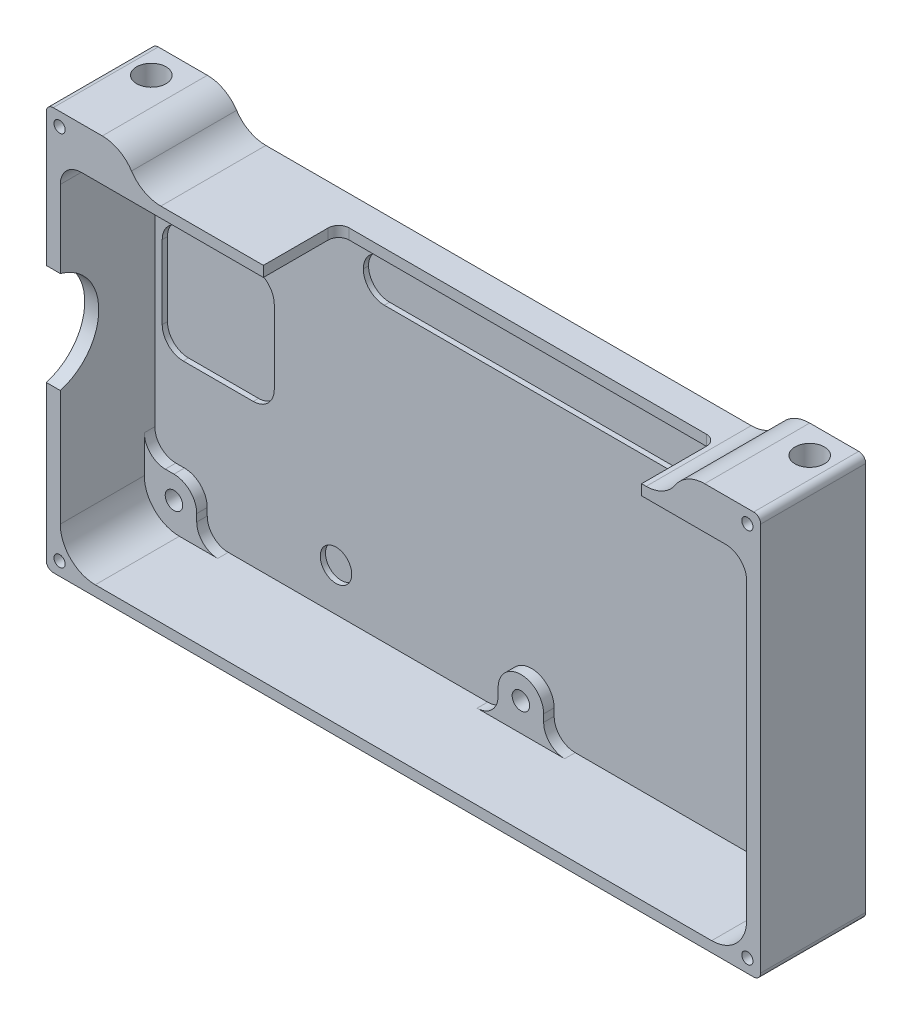
from build123d import *

# Parameters (mm, degrees)
SKIZZE1_W                                 = 98
SKIZZE1_H                                 = 50
SKIZZE1_W_2                               = 102
SKIZZE1_H_2                               = 57.5
AUFSATZ_LINEAR_AUSTRAGEN1_DEPTH           = 15
SKIZZE4_W                                 = 98
SKIZZE4_H                                 = 50
SCHNITT_LINEAR_AUSTRAGEN1_DEPTH           = 13.5
SKIZZE5_R                                 = 3.25
AUFSATZ_LINEAR_AUSTRAGEN2_DEPTH           = 1.5
SCHNITT_LINEAR_AUSTRAGEN3_REACH           = 120.048
SCHNITT_LINEAR_AUSTRAGEN4_REACH           = 120.048
AUFSATZ_LINEAR_AUSTRAGEN3_DEPTH           = 1.5
M3_GEWINDEBOHRUNG1_D                      = 2.5
GEWINDEBOHRUNG_F_R_M4X0_7_HELICOIL1_D     = 4.2
GEWINDEBOHRUNG_F_R_M4X0_7_HELICOIL1_DEPTH = 4
GEWINDEBOHRUNG_F_R_M4X0_7_HELICOIL1_TIP   = 1.2618073
VERRUNDUNG1_R                             = 5
VERRUNDUNG2_R                             = 3
VERRUNDUNG3_R                             = 1
VERRUNDUNG4_R                             = 3
M2_GEWINDEBOHRUNG1_D                      = 1.6
M2_GEWINDEBOHRUNG1_DEPTH                  = 6
M2_GEWINDEBOHRUNG1_TIP                    = 0.480688495
SCHNITT_LINEAR_AUSTRAGEN5_DEPTH           = 119.047659867
SKIZZE20_R                                = 2.25
AUFSATZ_LINEAR_AUSTRAGEN4_DEPTH           = 3
VERRUNDUNG5_R                             = 3
SKIZZE21_R                                = 2.25
SKIZZE21_W                                = 52
SKIZZE21_H                                = 6
SKIZZE21_W_2                              = 16
SKIZZE21_H_2                              = 16.5
SKIZZE21_W_3                              = 6
SKIZZE21_H_3                              = 10
SCHNITT_LINEAR_AUSTRAGEN6_DEPTH           = 0.75
VERRUNDUNG6_R                             = 3


with BuildPart() as part:
    # Skizze1 → Aufsatz-Linear austragen1 (new body)
    with BuildSketch(Plane.XY):
        with Locations((51, 26.5)):
            Rectangle(SKIZZE1_W, SKIZZE1_H)
        with Locations((51, 28.75)):
            Rectangle(SKIZZE1_W_2, SKIZZE1_H_2)
    extrude(amount=AUFSATZ_LINEAR_AUSTRAGEN1_DEPTH)

    # Skizze4 → Schnitt-Linear austragen1 (cut)
    with BuildSketch(Plane.XY.offset(15)):
        with Locations((51, 26.5)):
            Rectangle(SKIZZE4_W, SKIZZE4_H)
    extrude(amount=-SCHNITT_LINEAR_AUSTRAGEN1_DEPTH, mode=Mode.SUBTRACT)

    # Skizze5 → Aufsatz-Linear austragen2 (add)
    with BuildSketch(Plane.XY.offset(1.5)):
        with Locations((6.235, 5.55)):
            Circle(SKIZZE5_R)
        with Locations((55.765, 5.55)):
            Circle(SKIZZE5_R)
        with Locations((95.765, 5.55)):
            Circle(SKIZZE5_R)
        with Locations((95.765, 47.45)):
            Circle(SKIZZE5_R)
        with Locations((6.235, 47.45)):
            Circle(SKIZZE5_R)
    extrude(amount=AUFSATZ_LINEAR_AUSTRAGEN2_DEPTH)

    # Skizze11 → Schnitt-Linear austragen3 (cut, up to next)
    with BuildSketch(Plane.ZY, mode=Mode.PRIVATE) as schnitt_linear_austragen3_sk1:
        with BuildLine():
            Line((17, 37.75), (17, 22.75))
            ThreePointArc((17, 22.75), (9.5, 30.25), (17, 37.75))
        make_face()
    schnitt_linear_austragen3_tool1 = extrude(schnitt_linear_austragen3_sk1.sketch, amount=-SCHNITT_LINEAR_AUSTRAGEN3_REACH, mode=Mode.PRIVATE) & part.part
    add(schnitt_linear_austragen3_tool1.solids().sort_by_distance((0, 30.25, 13.816901))[0], mode=Mode.SUBTRACT)

    # Skizze12 → Schnitt-Linear austragen4 (cut, up to next)
    with BuildSketch(Plane(origin=(0, 57.5, 0), x_dir=(1, 0, 0), z_dir=(0, 1, 0)), mode=Mode.PRIVATE) as schnitt_linear_austragen4_sk1:
        with BuildLine():
            Line((85, -5.75), (85, -15))
            Line((85, -15), (31, -15))
            Line((31, -15), (31, -5.75))
            ThreePointArc((31, -5.75), (31.439339828, -4.689339828), (32.5, -4.25))
            Line((32.5, -4.25), (83.5, -4.25))
            ThreePointArc((83.5, -4.25), (84.560660172, -4.689339828), (85, -5.75))
        make_face()
    schnitt_linear_austragen4_tool1 = extrude(schnitt_linear_austragen4_sk1.sketch, amount=-SCHNITT_LINEAR_AUSTRAGEN4_REACH, mode=Mode.PRIVATE) & part.part
    add(schnitt_linear_austragen4_tool1.solids().sort_by_distance((58, 57.5, 9.633398))[0], mode=Mode.SUBTRACT)

    # Skizze13 → Aufsatz-Linear austragen3 (add)
    with BuildSketch(Plane.XY.offset(1.5)):
        with BuildLine():
            Line((6.235, 44.2), (2, 44.2))
            Line((2, 44.2), (2, 51.5))
            Line((2, 51.5), (9.485, 51.5))
            Line((9.485, 51.5), (9.485, 47.45))
            ThreePointArc((9.485, 47.45), (8.533097039, 45.151902961), (6.235, 44.2))
        make_face()
        with BuildLine():
            Line((9.485, 5.55), (9.485, 1.5))
            Line((9.485, 1.5), (2, 1.5))
            Line((2, 1.5), (2, 8.8))
            Line((2, 8.8), (6.235, 8.8))
            ThreePointArc((6.235, 8.8), (8.533097039, 7.848097039), (9.485, 5.55))
        make_face()
        with BuildLine():
            Line((100, 1.5), (100, 8.8))
            Line((100, 8.8), (95.765, 8.8))
            ThreePointArc((95.765, 8.8), (93.466902961, 7.848097039), (92.515, 5.55))
            Line((92.515, 5.55), (92.515, 1.5))
            Line((92.515, 1.5), (100, 1.5))
        make_face()
        with BuildLine():
            Line((100, 51.5), (92.515, 51.5))
            Line((92.515, 51.5), (92.515, 47.45))
            ThreePointArc((92.515, 47.45), (93.466902961, 45.151902961), (95.765, 44.2))
            Line((95.765, 44.2), (100, 44.2))
            Line((100, 44.2), (100, 51.5))
        make_face()
        with BuildLine():
            Line((59.015, 5.55), (59.015, 1.5))
            Line((59.015, 1.5), (52.515, 1.5))
            Line((52.515, 1.5), (52.515, 5.55))
            ThreePointArc((52.515, 5.55), (55.765, 8.8), (59.015, 5.55))
        make_face()
    extrude(amount=AUFSATZ_LINEAR_AUSTRAGEN3_DEPTH)

    # M3 Gewindebohrung1 (through all)
    with Locations(Plane.XY.offset(3)):
        with Locations((6.235, 47.45), (6.235, 5.55), (55.765, 5.55), (95.765, 47.45), (95.765, 5.55)):
            Hole(M3_GEWINDEBOHRUNG1_D / 2)

    # Gewindebohrung für M4x0.7 Helicoil1
    with Locations(Plane(origin=(38.515151917, 57.5, 4.646014508), x_dir=(-1, 0, 0), z_dir=(0, 1, 0))):
        with Locations((34.515151917, -0.646014508), (-59.484848083, -0.646014508)):
            Hole(GEWINDEBOHRUNG_F_R_M4X0_7_HELICOIL1_D / 2, depth=GEWINDEBOHRUNG_F_R_M4X0_7_HELICOIL1_DEPTH)
            with Locations((0, 0, -(GEWINDEBOHRUNG_F_R_M4X0_7_HELICOIL1_DEPTH + GEWINDEBOHRUNG_F_R_M4X0_7_HELICOIL1_TIP / 2))):  # 118° drill point
                Cone(0, GEWINDEBOHRUNG_F_R_M4X0_7_HELICOIL1_D / 2, GEWINDEBOHRUNG_F_R_M4X0_7_HELICOIL1_TIP, mode=Mode.SUBTRACT)

    # Verrundung1
    verrundung1_edges = [part.edges().sort_by_distance(p)[0] for p in [
        (2, 1.5, 9),
        (100, 1.5, 9),
    ]]
    fillet(verrundung1_edges, radius=VERRUNDUNG1_R)

    # Verrundung2
    verrundung2_edges = [part.edges().sort_by_distance(p)[0] for p in [
        (100, 44.2, 2.25),
        (92.515, 51.5, 2.25),
        (9.485, 51.5, 2.25),
        (2, 44.2, 2.25),
        (52.515, 1.5, 2.25),
        (59.015, 1.5, 2.25),
        (9.485, 1.5, 2.25),
        (2, 8.8, 2.25),
        (92.515, 1.5, 2.25),
        (100, 8.8, 2.25),
    ]]
    fillet(verrundung2_edges, radius=VERRUNDUNG2_R)

    # Verrundung3
    verrundung3_edges = [part.edges().sort_by_distance(p)[0] for p in [
        (0, 0, 7.5),
        (0, 57.5, 7.5),
        (102, 57.5, 7.5),
        (102, 0, 7.5),
    ]]
    fillet(verrundung3_edges, radius=VERRUNDUNG3_R)

    # Verrundung4
    verrundung4_edges = [part.edges().sort_by_distance(p)[0] for p in [
        (100, 51.5, 9),
        (2, 51.5, 9),
    ]]
    fillet(verrundung4_edges, radius=VERRUNDUNG4_R)

    # M2 Gewindebohrung1
    with Locations(Plane.XY.offset(15)):
        with Locations((1.9, 55.6), (100.1, 55.6), (100.1, 1.9), (1.9, 1.9)):
            Hole(M2_GEWINDEBOHRUNG1_D / 2, depth=M2_GEWINDEBOHRUNG1_DEPTH)
            with Locations((0, 0, -(M2_GEWINDEBOHRUNG1_DEPTH + M2_GEWINDEBOHRUNG1_TIP / 2))):  # 118° drill point
                Cone(0, M2_GEWINDEBOHRUNG1_D / 2, M2_GEWINDEBOHRUNG1_TIP, mode=Mode.SUBTRACT)

    # Skizze19 → Schnitt-Linear austragen5 (cut, through all)
    with BuildSketch(Plane.XY.offset(15)):
        with BuildLine():
            Line((94, 57.5), (8, 57.5))
            ThreePointArc((8, 57.5), (10.371708245, 56.901704215), (12.175823272, 55.25))
            ThreePointArc((12.175823272, 55.25), (13.979938299, 53.598295785), (16.351646544, 53))
            Line((16.351646544, 53), (85.648353456, 53))
            ThreePointArc((85.648353456, 53), (88.020061701, 53.598295785), (89.824176728, 55.25))
            ThreePointArc((89.824176728, 55.25), (91.628291755, 56.901704215), (94, 57.5))
        make_face()
    extrude(amount=-SCHNITT_LINEAR_AUSTRAGEN5_DEPTH, mode=Mode.SUBTRACT)

    # Skizze20 → Aufsatz-Linear austragen4 (add)
    with BuildSketch(Plane(origin=(0, 0, 0), x_dir=(-1, 0, 0), z_dir=(0, 0, -1))):
        Polygon((-47, -8), (-51, -8), (-55, -8), (-55, 0), (-47, 0), align=None)
        with Locations((-51, -4)):
            Circle(SKIZZE20_R, mode=Mode.SUBTRACT)
    extrude(amount=-AUFSATZ_LINEAR_AUSTRAGEN4_DEPTH)

    # Verrundung5
    verrundung5_edges = [part.edges().sort_by_distance(p)[0] for p in [
        (55, -8, 1.5),
        (55, 0, 1.5),
        (47, 0, 1.5),
        (47, -8, 1.5),
    ]]
    fillet(verrundung5_edges, radius=VERRUNDUNG5_R)

    # Skizze21 → Schnitt-Linear austragen6 (cut)
    with BuildSketch(Plane.XY.offset(1.5)):
        with Locations((89.465, 7.6)):
            Circle(SKIZZE21_R)
        with Locations((27.865, 7.6)):
            Circle(SKIZZE21_R)
        with Locations((57.765, 46.2)):
            Rectangle(SKIZZE21_W, SKIZZE21_H)
        with Locations((11.055, 30.2)):
            Rectangle(SKIZZE21_W_2, SKIZZE21_H_2)
        with Locations((97, 35.71)):
            Rectangle(SKIZZE21_W_3, SKIZZE21_H_3)
    extrude(amount=-SCHNITT_LINEAR_AUSTRAGEN6_DEPTH, mode=Mode.SUBTRACT)

    # Verrundung6
    verrundung6_edges = [part.edges().sort_by_distance(p)[0] for p in [
        (3.055, 21.95, 1.125),
        (3.055, 38.45, 1.125),
        (19.055, 38.45, 1.125),
        (19.055, 21.95, 1.125),
        (31.765, 43.2, 1.125),
        (31.765, 49.2, 1.125),
        (83.765, 49.2, 1.125),
        (83.765, 43.2, 1.125),
        (100, 30.71, 1.125),
        (94, 30.71, 1.125),
        (94, 40.71, 1.125),
        (100, 40.71, 1.125),
    ]]
    fillet(verrundung6_edges, radius=VERRUNDUNG6_R - 0.0001)  # a hair under: the kernel refuses the full size


solid = part.part
